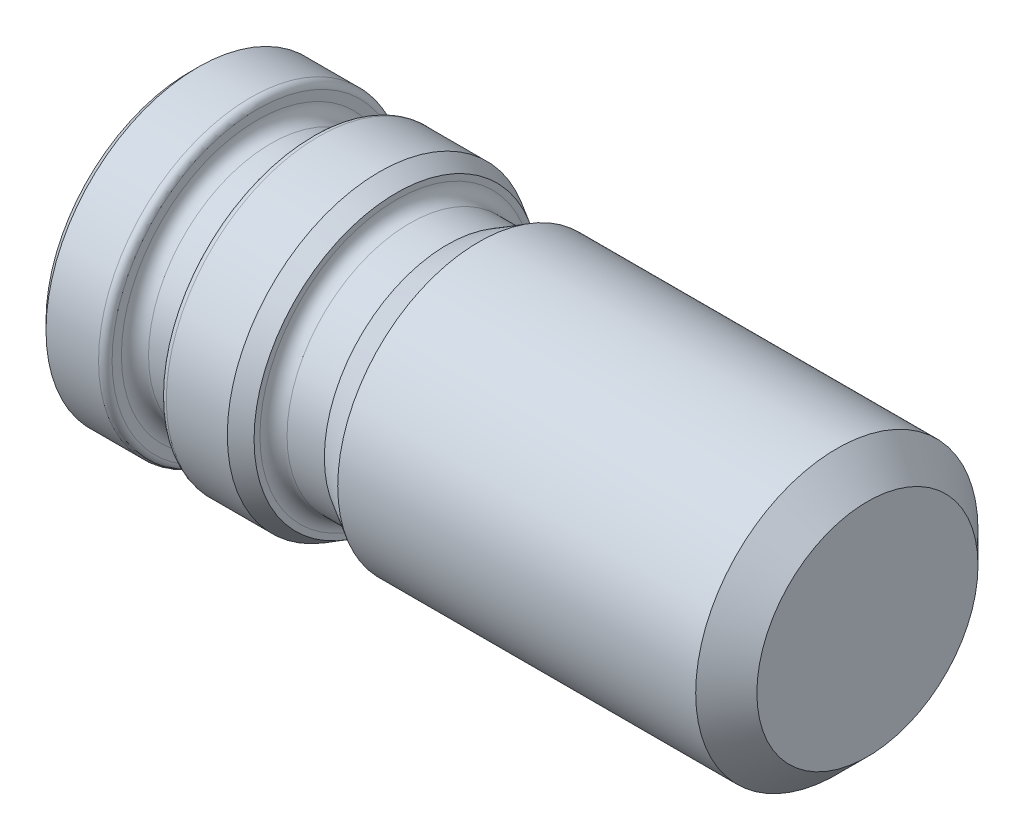
from build123d import *

# Parameters (mm, degrees)
CUT_EXTRUDE1_DEPTH = 8
CHAMFER1_SIZE      = 0.5
CHAMFER2_SIZE      = 0.5
CHAMFER3_SIZE      = 1
CHAMFER3_SIZE2     = 0.577350269


with BuildPart() as part:
    # Sketch1 → Revolve1 (revolve)
    with BuildSketch(Plane.XY):
        with BuildLine():
            Line((0, 0), (0, 6.525))
            Line((0, 6.525), (-1.805, 8.33))
            Line((-1.805, 8.33), (-22.929385128, 8.33))
            Line((-22.929385128, 8.33), (-24.8, 7.25))
            Line((-24.8, 7.25), (-27, 7.25))
            ThreePointArc((-27, 7.25), (-27.565685425, 7.484314575), (-27.8, 8.05))
            Line((-27.8, 8.05), (-27.8, 8.975))
            Line((-27.8, 8.975), (-32.4, 8.975))
            ThreePointArc((-32.4, 8.975), (-32.682842712, 8.857842712), (-32.8, 8.575))
            Line((-32.8, 8.575), (-32.8, 8.025))
            ThreePointArc((-32.8, 8.025), (-33.034314575, 7.459314575), (-33.6, 7.225))
            Line((-33.6, 7.225), (-35.2, 7.225))
            ThreePointArc((-35.2, 7.225), (-35.765685425, 7.459314575), (-36, 8.025))
            Line((-36, 8.025), (-36, 8.575))
            ThreePointArc((-36, 8.575), (-36.117157288, 8.857842712), (-36.4, 8.975))
            Line((-36.4, 8.975), (-40, 8.975))
            Line((-40, 8.975), (-40, 0))
            Line((-40, 0), (0, 0))
        make_face()
    revolve(axis=Axis((0, 0, 0), (1, 0, 0)))

    # Sketch2 → Cut-Extrude1 (cut)
    with BuildSketch(Plane.ZY.offset(40)):
        Polygon((2.367136104, 4.1), (-2.367136104, 4.1), (-4.734272207, 0), (-2.367136104, -4.1), (2.367136104, -4.1), (4.734272207, 0), align=None)
    extrude(amount=-CUT_EXTRUDE1_DEPTH, mode=Mode.SUBTRACT)

    # Chamfer1
    chamfer1_edges = [part.edges().sort_by_distance(p)[0] for p in [
        (-40, 2.05, -3.550704156),
        (-40, -2.05, -3.550704156),
        (-40, -4.1, 0),
        (-40, -2.05, 3.550704156),
        (-40, 2.05, 3.550704156),
        (-40, 4.1, 0),
    ]]
    chamfer(chamfer1_edges, length=CHAMFER1_SIZE)

    # Chamfer2
    chamfer2_edges = [part.edges().sort_by_distance(p)[0] for p in [
        (-40, -8.975, 0),
    ]]
    chamfer(chamfer2_edges, length=CHAMFER2_SIZE)

    # Chamfer3
    chamfer3_edges = [part.edges().sort_by_distance(p)[0] for p in [
        (-27.8, -8.975, 0),
    ]]
    chamfer3_side = [part.faces().sort_by_distance(p)[0] for p in [
        (-30.1, -8.975, 0),
    ]]
    chamfer(chamfer3_edges, length=CHAMFER3_SIZE, length2=CHAMFER3_SIZE2, reference=chamfer3_side[0])


solid = part.part
